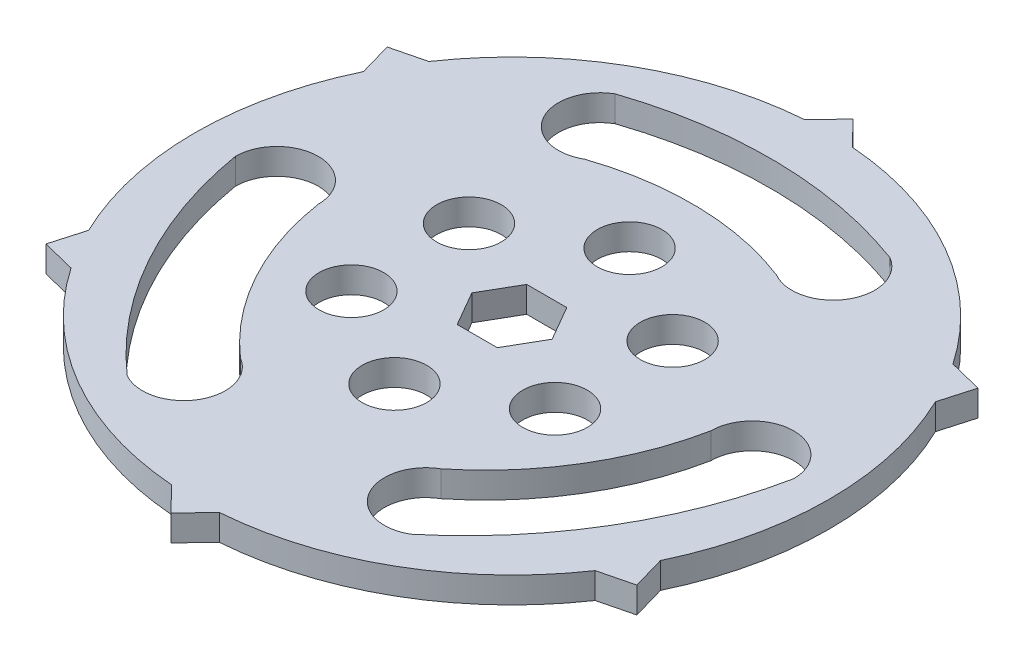
from build123d import *

# Parameters (mm, degrees)
SKETCH2_R           = 3.117135343
BOSS_EXTRUDE2_DEPTH = 2.5


with BuildPart() as part:
    # Sketch2 → Boss-Extrude2 (new body)
    with BuildSketch(Plane(origin=(0, 0, 0), x_dir=(1, 0, 0), z_dir=(0, 1, 0))):
        with BuildLine():
            Line((0, 32.906969052), (2.306503491, 30.518840772))
            ThreePointArc((2.306503491, 30.518840772), (15.30293763, 26.50546548), (25.276839657, 17.256911003))
            Line((25.276839657, 17.256911003), (28.49827116, 16.453484526))
            Line((28.49827116, 16.453484526), (27.583343148, 13.261929769))
            ThreePointArc((27.583343148, 13.261929769), (30.605875259, 0), (27.583343148, -13.261929769))
            Line((27.583343148, -13.261929769), (28.49827116, -16.453484526))
            Line((28.49827116, -16.453484526), (25.276839657, -17.256911003))
            ThreePointArc((25.276839657, -17.256911003), (15.30293763, -26.50546548), (2.306503491, -30.518840772))
            Line((2.306503491, -30.518840772), (0, -32.906969052))
            Line((0, -32.906969052), (-2.306503491, -30.518840772))
            ThreePointArc((-2.306503491, -30.518840772), (-15.30293763, -26.50546548), (-25.276839657, -17.256911003))
            Line((-25.276839657, -17.256911003), (-28.49827116, -16.453484526))
            Line((-28.49827116, -16.453484526), (-27.583343148, -13.261929769))
            ThreePointArc((-27.583343148, -13.261929769), (-30.605875259, 0), (-27.583343148, 13.261929769))
            Line((-27.583343148, 13.261929769), (-28.49827116, 16.453484526))
            Line((-28.49827116, 16.453484526), (-25.276839657, 17.256911003))
            ThreePointArc((-25.276839657, 17.256911003), (-15.30293763, 26.50546548), (-2.306503491, 30.518840772))
            Line((-2.306503491, 30.518840772), (0, 32.906969052))
        make_face()
        with Locations((0, 11.341163878)):
            Circle(SKETCH2_R, mode=Mode.SUBTRACT)
        with Locations((9.821736026, 5.670581939)):
            Circle(SKETCH2_R, mode=Mode.SUBTRACT)
        with Locations((9.821736026, -5.670581939)):
            Circle(SKETCH2_R, mode=Mode.SUBTRACT)
        with Locations((0, -11.341163878)):
            Circle(SKETCH2_R, mode=Mode.SUBTRACT)
        with Locations((-9.821736026, -5.670581939)):
            Circle(SKETCH2_R, mode=Mode.SUBTRACT)
        with Locations((-9.821736026, 5.670581939)):
            Circle(SKETCH2_R, mode=Mode.SUBTRACT)
        Polygon((3.87, 0), (1.935, 3.351518313), (-1.935, 3.351518313), (-3.87, 0), (-1.935, -3.351518313), (1.935, -3.351518313), align=None, mode=Mode.SUBTRACT)
        with BuildLine():
            ThreePointArc((9.342387857, -16.181490431), (7.878286241, -21.645592047), (13.342387857, -23.109693662))
            ThreePointArc((13.342387857, -23.109693662), (22.243850303, -12.742742909), (27.176618771, 0))
            ThreePointArc((27.176618771, 0), (23.176618771, 4), (19.176618771, 0))
            ThreePointArc((19.176618771, 0), (15.689202052, -8.959638448), (9.342387857, -16.181490431))
        make_face(mode=Mode.SUBTRACT)
        with BuildLine():
            ThreePointArc((-18.684775713, 0), (-22.684775713, 4), (-26.684775713, 0))
            ThreePointArc((-26.684775713, 0), (-22.157464224, -12.892367986), (-13.588309386, -23.535642245))
            ThreePointArc((-13.588309386, -23.535642245), (-8.124207771, -22.07154063), (-9.588309386, -16.607439015))
            ThreePointArc((-9.588309386, -16.607439015), (-15.603875531, -9.107428318), (-18.684775713, 0))
        make_face(mode=Mode.SUBTRACT)
        with BuildLine():
            ThreePointArc((9.342387857, 16.181490431), (14.806489472, 17.645592047), (13.342387857, 23.109693662))
            ThreePointArc((13.342387857, 23.109693662), (-0.086386079, 25.635110894), (-13.588309386, 23.535642245))
            ThreePointArc((-13.588309386, 23.535642245), (-15.052411001, 18.07154063), (-9.588309386, 16.607439015))
            ThreePointArc((-9.588309386, 16.607439015), (-0.085326521, 18.067066766), (9.342387857, 16.181490431))
        make_face(mode=Mode.SUBTRACT)
    extrude(amount=BOSS_EXTRUDE2_DEPTH)


solid = part.part
